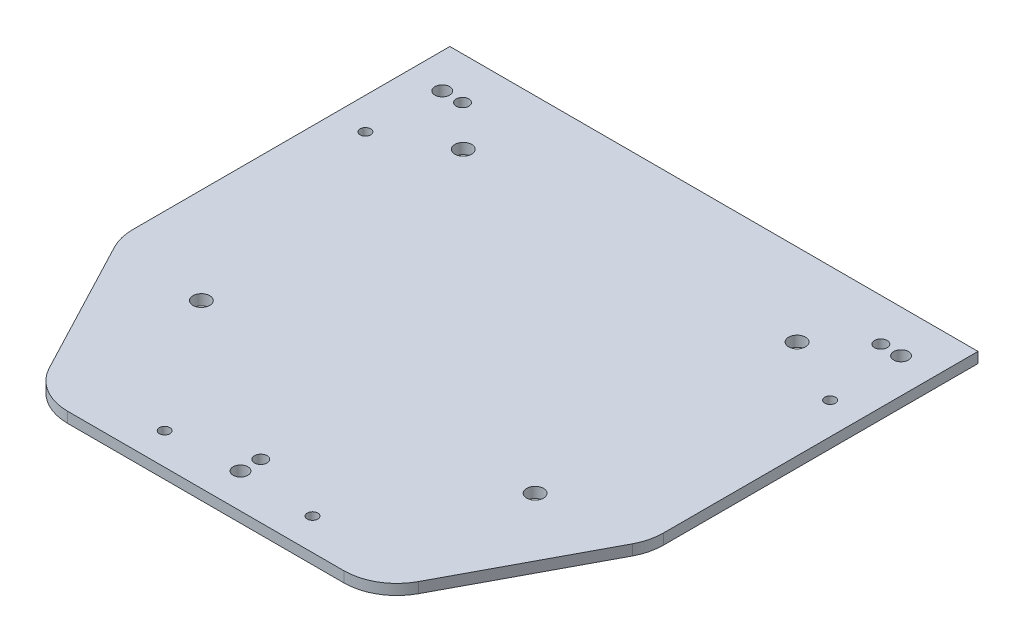
from build123d import *

# Parameters (mm, degrees)
RESSALTO_EXTRUS_O4_DEPTH = 5
ESBO_O2_R                = 2.5
CORTE_EXTRUS_O1_DEPTH    = 5
ESBO_O3_R                = 4
CORTE_EXTRUS_O2_DEPTH    = 5
ESBO_O4_R                = 3.5
ESBO_O4_R_2              = 3
CORTE_EXTRUS_O3_DEPTH    = 10


with BuildPart() as part:
    # Esboço1 → Ressalto-extrusão4 (new body)
    with BuildSketch(Plane(origin=(0, 0, 0), x_dir=(1, 0, 0), z_dir=(0, 1, 0))):
        with BuildLine():
            Line((649.267355398, 124.203004206), (399.267355398, 124.203004206))
            Line((399.267355398, 124.203004206), (399.267355398, 84.203004206))
            Line((399.267355398, 84.203004206), (399.267355398, -25.823867232))
            ThreePointArc((399.267355398, -25.823867232), (399.994184105, -31.80827659), (402.132407827, -37.444714707))
            Line((402.132407827, -37.444714707), (436.243300323, -102.417843269))
            ThreePointArc((436.243300323, -102.417843269), (445.44614031, -112.192336255), (458.378247894, -115.796995794))
            Line((458.378247894, -115.796995794), (504.267355398, -115.796995794))
            Line((504.267355398, -115.796995794), (544.267355398, -115.796995794))
            Line((544.267355398, -115.796995794), (589.136322684, -115.796995794))
            ThreePointArc((589.136322684, -115.796995794), (602.010224955, -112.227409704), (611.207767027, -102.53800702))
            Line((611.207767027, -102.53800702), (646.338799741, -36.496622823))
            ThreePointArc((646.338799741, -36.496622823), (648.524169993, -30.805979), (649.267355398, -24.755611597))
            Line((649.267355398, -24.755611597), (649.267355398, 84.203004206))
            Line((649.267355398, 84.203004206), (649.267355398, 124.203004206))
        make_face()
    extrude(amount=RESSALTO_EXTRUS_O4_DEPTH)

    # Esboço2 → Corte-extrusão1 (cut)
    with BuildSketch(Plane(origin=(0, 5, 0), x_dir=(1, 0, 0), z_dir=(0, 1, 0))):
        with Locations((559.267355398, -100.796995794)):
            Circle(ESBO_O2_R)
        with Locations((489.267355398, -100.796995794)):
            Circle(ESBO_O2_R)
        with Locations((634.267355398, 69.203004206)):
            Circle(ESBO_O2_R)
        with Locations((414.267355398, 69.203004206)):
            Circle(ESBO_O2_R)
    extrude(amount=-CORTE_EXTRUS_O1_DEPTH, mode=Mode.SUBTRACT)

    # Esboço3 → Corte-extrusão2 (cut)
    with BuildSketch(Plane(origin=(0, 5, 0), x_dir=(1, 0, 0), z_dir=(0, 1, 0))):
        with Locations((602.59531099, 85.223299861)):
            Circle(ESBO_O3_R)
        with Locations((444.59531099, 85.223299861)):
            Circle(ESBO_O3_R)
        with Locations((602.59531099, -38.776700139)):
            Circle(ESBO_O3_R)
        with Locations((444.59531099, -38.776700139)):
            Circle(ESBO_O3_R)
    extrude(amount=-CORTE_EXTRUS_O2_DEPTH, mode=Mode.SUBTRACT)

    # Esboço4 → Corte-extrusão3 (cut)
    with BuildSketch(Plane(origin=(0, 5, 0), x_dir=(1, 0, 0), z_dir=(0, 1, 0))):
        with Locations((523.757285289, -99.396995794)):
            Circle(ESBO_O4_R)
        with Locations((632.867355398, 104.203004206)):
            Circle(ESBO_O4_R)
        with Locations((415.667355398, 104.203004206)):
            Circle(ESBO_O4_R)
        with Locations((623.267355398, 104.203004206)):
            Circle(ESBO_O4_R_2)
        with Locations((425.267355398, 104.203004206)):
            Circle(ESBO_O4_R_2)
        with Locations((523.757285289, -89.796995794)):
            Circle(ESBO_O4_R_2)
    extrude(amount=-CORTE_EXTRUS_O3_DEPTH, mode=Mode.SUBTRACT)


solid = part.part
